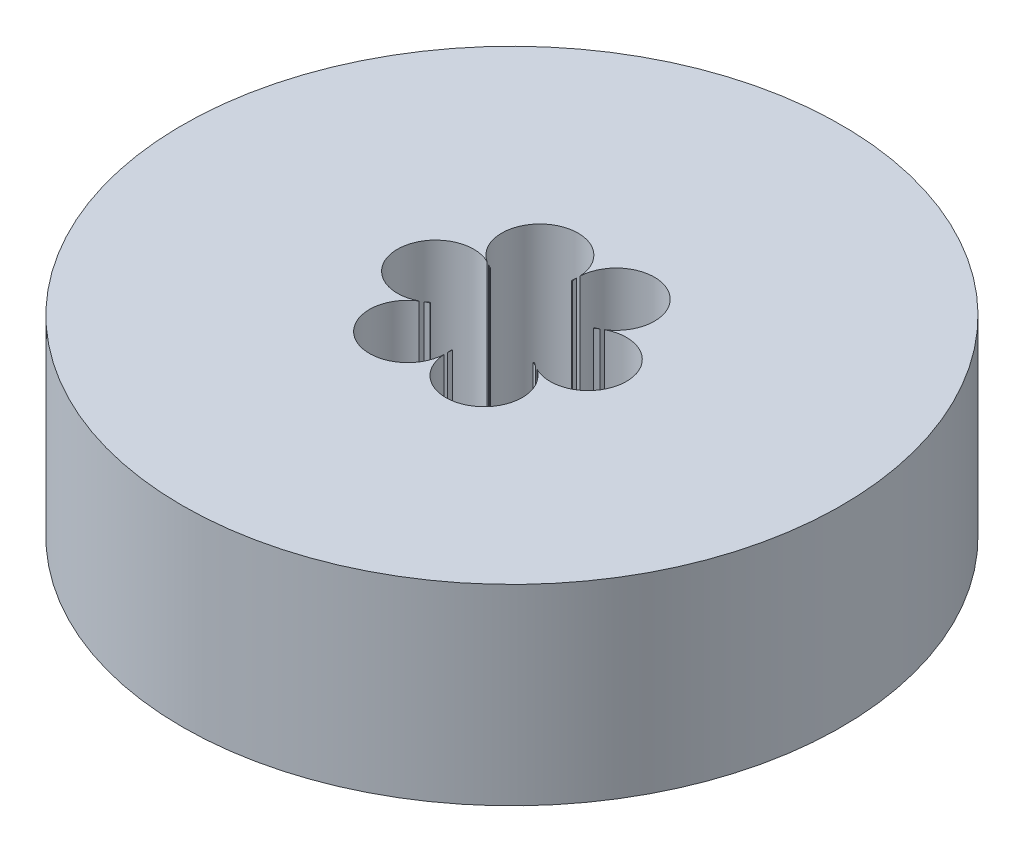
from build123d import *

# Parameters (mm, degrees)
SKETCH1_R           = 27.5
BOSS_EXTRUDE1_DEPTH = 16
SKETCH2_R           = 5
CUT_EXTRUDE1_DEPTH  = 43.053537307
SKETCH3_R           = 3.188575247
CUT_EXTRUDE2_DEPTH  = 15.2756379
CIRPATTERN1_COUNT   = 6


with BuildPart() as part:
    # Sketch1 → Boss-Extrude1 (new body)
    with BuildSketch(Plane(origin=(0, 0, 0), x_dir=(1, 0, 0), z_dir=(0, 1, 0))):
        Circle(SKETCH1_R)
    extrude(amount=BOSS_EXTRUDE1_DEPTH)

    # Sketch2 → Cut-Extrude1 (cut, through all)
    with BuildSketch(Plane(origin=(0, 0, 0), x_dir=(1, 0, 0), z_dir=(0, 1, 0))):
        Circle(SKETCH2_R)
    extrude(amount=CUT_EXTRUDE1_DEPTH, mode=Mode.SUBTRACT)

    # Sketch3 → Cut-Extrude2 (cut)
    with BuildSketch(Plane(origin=(0, 16, 0), x_dir=(1, 0, 0), z_dir=(0, 1, 0))):
        with Locations((-6.370430977, 0)):
            Circle(SKETCH3_R)
    cut_extrude2 = extrude(amount=-CUT_EXTRUDE2_DEPTH, mode=Mode.SUBTRACT)

    # CirPattern1: Cut-Extrude2 ×6 about axis
    cirpattern1_axis = Axis((0, 0, 0), (0, 1, 0))
    for i in range(1, CIRPATTERN1_COUNT):
        add(cut_extrude2.rotate(cirpattern1_axis, i * 360 / CIRPATTERN1_COUNT), mode=Mode.SUBTRACT)


solid = part.part
